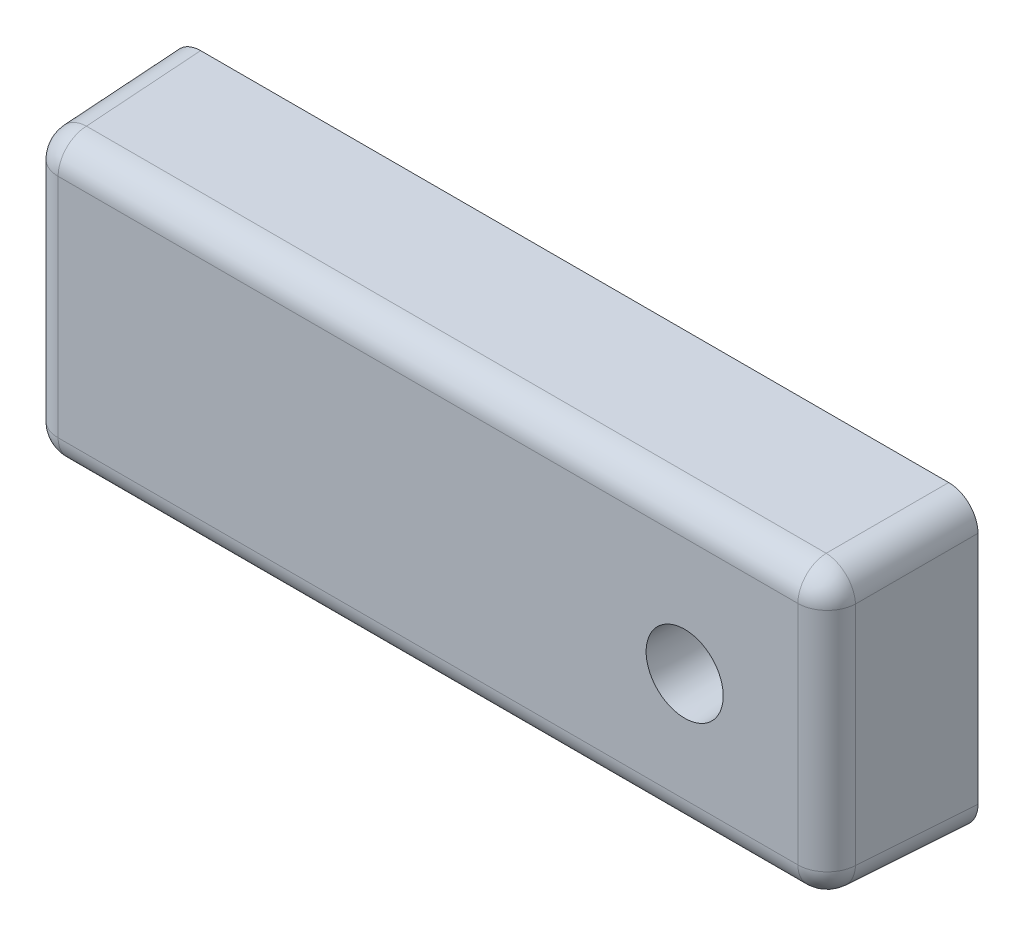
from build123d import *

# Parameters (mm, degrees)
SKETCH1_W           = 55
SKETCH1_H           = 20
SKETCH1_R           = 2.279195974
BOSS_EXTRUDE1_DEPTH = 10
BOSS_EXTRUDE1_DRAFT = 2
FILLET1_R           = 2
FILLET2_R           = 2


with BuildPart() as part:
    # Sketch1 → Boss-Extrude1 (with draft: the straight prism first)
    with BuildSketch(Plane.XY):
        with Locations((-40.5, 12.750475985)):
            Rectangle(SKETCH1_W, SKETCH1_H)
        with Locations((-22.9997867, 12.458174308)):
            Circle(SKETCH1_R, mode=Mode.SUBTRACT)
    extrude(amount=BOSS_EXTRUDE1_DEPTH)
    # Boss-Extrude1: the draft: its side faces are tilted about the plane it starts from
    boss_extrude1_sides = [part.faces().sort_by_distance(p)[0] for p in [
        (-13, 12.750475985, 5),
        (-40.5, 22.750475985, 5),
        (-68, 12.750475985, 5),
        (-40.5, 2.750475985, 5),
        (-25.278982673, 12.458174308, 5),
    ]]
    draft(boss_extrude1_sides, Plane.XY, BOSS_EXTRUDE1_DRAFT)

    # Fillet1
    fillet1_edges = [part.edges().sort_by_distance(p)[0] for p in [
        (-67.650792305, 12.750475985, 10),
        (-40.5, 3.09968368, 10),
        (-13.349207695, 12.750475985, 10),
        (-40.5, 22.40126829, 10),
    ]]
    fillet(fillet1_edges, radius=FILLET1_R)

    # Fillet2
    # the kernel refuses this fillet: 2 mm, written as the material it takes off along each edge
    with BuildSketch(Plane(origin=(-65.719414755, 20.469890741, 8), x_dir=(-0.719128245661317, 0.024250870657585206, -0.6944540744818377), z_dir=(-0.5638062984383352, 0.5638062984383351, 0.6035270629247093))) as fillet2_piece_1_section:
        Polygon((-4.062392326, -4.062392326), (4.062392326, -4.062392326), (4.062392326, 4.062392326), (-4.062392326, 4.062392326), align=None)
    fillet2_piece_1 = extrude(amount=4.062392326, mode=Mode.PRIVATE)
    fillet2_piece_1 = split(fillet2_piece_1, bisect_by=Plane(origin=(-65.719414755, 20.469890741, 8), z_dir=(0.03487826274237467, -0.03487826274237466, 0.9987827659587183)), keep=Keep.TOP, mode=Mode.PRIVATE)
    fillet2_piece_1 = split(fillet2_piece_1, bisect_by=Plane(origin=(-65.719414755, 20.469890741, 8), z_dir=(0, 1, 0)), keep=Keep.TOP, mode=Mode.PRIVATE)
    fillet2_piece_1 = split(fillet2_piece_1, bisect_by=Plane(origin=(-65.719414755, 20.469890741, 8), z_dir=(-1, 0, 0)), keep=Keep.TOP, mode=Mode.PRIVATE)
    fillet2_piece_1 = split(fillet2_piece_1, bisect_by=Plane(origin=(-65.719414755, 22.468672395, 8.069798993), z_dir=(0, -0.9993908270190958, -0.03489949670250102)), keep=Keep.TOP, mode=Mode.PRIVATE)
    fillet2_piece_1 = split(fillet2_piece_1, bisect_by=Plane(origin=(-67.71819641, 20.469890741, 8.069798993), z_dir=(0.9993908270190958, 0, -0.03489949670250102)), keep=Keep.TOP, mode=Mode.PRIVATE)
    fillet2_piece_1 = split(fillet2_piece_1, bisect_by=Plane(origin=(-65.719414755, 20.469890741, 10), z_dir=(0, 0, -1)), keep=Keep.TOP, mode=Mode.PRIVATE)
    fillet2_piece_1 = fillet2_piece_1 - Plane(origin=(-65.719414755, 20.469890741, 8), x_dir=(0.5638062984383352, -0.5638062984383351, -0.6035270629247093), z_dir=(-0.719128245661317, 0.024250870657585206, -0.6944540744818377)) * Sphere(FILLET2_R, mode=Mode.PRIVATE)
    add(fillet2_piece_1, mode=Mode.SUBTRACT)
    with BuildSketch(Plane(origin=(-15.280585245, 20.469890741, 8), x_dir=(0.024250870657585296, 0.719128245661317, -0.6944540744818377), z_dir=(0.5638062984383351, 0.5638062984383351, 0.6035270629247093))) as fillet2_piece_2_section:
        Polygon((-4.062392326, -4.062392326), (4.062392326, -4.062392326), (4.062392326, 4.062392326), (-4.062392326, 4.062392326), align=None)
    fillet2_piece_2 = extrude(amount=4.062392326, mode=Mode.PRIVATE)
    fillet2_piece_2 = split(fillet2_piece_2, bisect_by=Plane(origin=(-15.280585245, 20.469890741, 8), z_dir=(-0.03487826274237467, -0.034878262742374676, 0.9987827659587183)), keep=Keep.TOP, mode=Mode.PRIVATE)
    fillet2_piece_2 = split(fillet2_piece_2, bisect_by=Plane(origin=(-15.280585245, 20.469890741, 8), z_dir=(1, 0, 0)), keep=Keep.TOP, mode=Mode.PRIVATE)
    fillet2_piece_2 = split(fillet2_piece_2, bisect_by=Plane(origin=(-15.280585245, 20.469890741, 8), z_dir=(0, 1, 0)), keep=Keep.TOP, mode=Mode.PRIVATE)
    fillet2_piece_2 = split(fillet2_piece_2, bisect_by=Plane(origin=(-13.28180359, 20.469890741, 8.069798993), z_dir=(-0.9993908270190958, 0, -0.03489949670250102)), keep=Keep.TOP, mode=Mode.PRIVATE)
    fillet2_piece_2 = split(fillet2_piece_2, bisect_by=Plane(origin=(-15.280585245, 22.468672395, 8.069798993), z_dir=(0, -0.9993908270190958, -0.03489949670250102)), keep=Keep.TOP, mode=Mode.PRIVATE)
    fillet2_piece_2 = split(fillet2_piece_2, bisect_by=Plane(origin=(-15.280585245, 20.469890741, 10), z_dir=(0, 0, -1)), keep=Keep.TOP, mode=Mode.PRIVATE)
    fillet2_piece_2 = fillet2_piece_2 - Plane(origin=(-15.280585245, 20.469890741, 8), x_dir=(-0.5638062984383351, -0.5638062984383351, -0.6035270629247093), z_dir=(0.024250870657585296, 0.719128245661317, -0.6944540744818377)) * Sphere(FILLET2_R, mode=Mode.PRIVATE)
    add(fillet2_piece_2, mode=Mode.SUBTRACT)
    with BuildSketch(Plane(origin=(-65.719414755, 5.03106123, 8), x_dir=(0.7191282456613168, 0.0242508706575854, 0.6944540744818378), z_dir=(-0.5638062984383351, -0.5638062984383351, 0.6035270629247093))) as fillet2_piece_3_section:
        Polygon((-4.062392326, -4.062392326), (4.062392326, -4.062392326), (4.062392326, 4.062392326), (-4.062392326, 4.062392326), align=None)
    fillet2_piece_3 = extrude(amount=4.062392326, mode=Mode.PRIVATE)
    fillet2_piece_3 = split(fillet2_piece_3, bisect_by=Plane(origin=(-65.719414755, 5.03106123, 8), z_dir=(0.03487826274237467, 0.034878262742374676, 0.9987827659587183)), keep=Keep.TOP, mode=Mode.PRIVATE)
    fillet2_piece_3 = split(fillet2_piece_3, bisect_by=Plane(origin=(-65.719414755, 5.03106123, 8), z_dir=(0, -1, 0)), keep=Keep.TOP, mode=Mode.PRIVATE)
    fillet2_piece_3 = split(fillet2_piece_3, bisect_by=Plane(origin=(-65.719414755, 5.03106123, 8), z_dir=(-1, 0, 0)), keep=Keep.TOP, mode=Mode.PRIVATE)
    fillet2_piece_3 = split(fillet2_piece_3, bisect_by=Plane(origin=(-65.719414755, 3.032279576, 8.069798993), z_dir=(0, 0.9993908270190958, -0.03489949670250102)), keep=Keep.TOP, mode=Mode.PRIVATE)
    fillet2_piece_3 = split(fillet2_piece_3, bisect_by=Plane(origin=(-67.71819641, 5.03106123, 8.069798993), z_dir=(0.9993908270190958, 0, -0.03489949670250102)), keep=Keep.TOP, mode=Mode.PRIVATE)
    fillet2_piece_3 = split(fillet2_piece_3, bisect_by=Plane(origin=(-65.719414755, 5.03106123, 10), z_dir=(0, 0, -1)), keep=Keep.TOP, mode=Mode.PRIVATE)
    fillet2_piece_3 = fillet2_piece_3 - Plane(origin=(-65.719414755, 5.03106123, 8), x_dir=(0.5638062984383351, 0.5638062984383351, -0.6035270629247093), z_dir=(0.7191282456613168, 0.0242508706575854, 0.6944540744818378)) * Sphere(FILLET2_R, mode=Mode.PRIVATE)
    add(fillet2_piece_3, mode=Mode.SUBTRACT)
    with BuildSketch(Plane(origin=(-15.280585245, 5.03106123, 8), x_dir=(-0.024250870657585296, 0.719128245661317, 0.6944540744818377), z_dir=(0.5638062984383352, -0.5638062984383351, 0.6035270629247093))) as fillet2_piece_4_section:
        Polygon((-4.062392326, -4.062392326), (4.062392326, -4.062392326), (4.062392326, 4.062392326), (-4.062392326, 4.062392326), align=None)
    fillet2_piece_4 = extrude(amount=4.062392326, mode=Mode.PRIVATE)
    fillet2_piece_4 = split(fillet2_piece_4, bisect_by=Plane(origin=(-15.280585245, 5.03106123, 8), z_dir=(-0.03487826274237467, 0.03487826274237466, 0.9987827659587183)), keep=Keep.TOP, mode=Mode.PRIVATE)
    fillet2_piece_4 = split(fillet2_piece_4, bisect_by=Plane(origin=(-15.280585245, 5.03106123, 8), z_dir=(1, 0, 0)), keep=Keep.TOP, mode=Mode.PRIVATE)
    fillet2_piece_4 = split(fillet2_piece_4, bisect_by=Plane(origin=(-15.280585245, 5.03106123, 8), z_dir=(0, -1, 0)), keep=Keep.TOP, mode=Mode.PRIVATE)
    fillet2_piece_4 = split(fillet2_piece_4, bisect_by=Plane(origin=(-13.28180359, 5.03106123, 8.069798993), z_dir=(-0.9993908270190958, 0, -0.03489949670250102)), keep=Keep.TOP, mode=Mode.PRIVATE)
    fillet2_piece_4 = split(fillet2_piece_4, bisect_by=Plane(origin=(-15.280585245, 3.032279576, 8.069798993), z_dir=(0, 0.9993908270190958, -0.03489949670250102)), keep=Keep.TOP, mode=Mode.PRIVATE)
    fillet2_piece_4 = split(fillet2_piece_4, bisect_by=Plane(origin=(-15.280585245, 5.03106123, 10), z_dir=(0, 0, -1)), keep=Keep.TOP, mode=Mode.PRIVATE)
    fillet2_piece_4 = fillet2_piece_4 - Plane(origin=(-15.280585245, 5.03106123, 8), x_dir=(-0.5638062984383352, 0.5638062984383351, -0.6035270629247093), z_dir=(-0.024250870657585296, 0.719128245661317, 0.6944540744818377)) * Sphere(FILLET2_R, mode=Mode.PRIVATE)
    add(fillet2_piece_4, mode=Mode.SUBTRACT)
    with BuildSketch(Plane(origin=(-12.825820961, 2.576296946, -4.987835068), x_dir=(0.0012172338155652697, 0.9993915682994698, -0.034857015847091166), z_dir=(-0.03487826274237467, 0.03487826274237466, 0.9987827659587183)), Plane(origin=(-68.174179039, 2.576296946, -4.987835068), x_dir=(0.99939156829947, -0.0012172338155659363, -0.034857015847091145), z_dir=(0.03487826274237467, 0.034878262742374676, 0.9987827659587183))) as fillet2_piece_5:
        with BuildLine():
            CenterArc((FILLET2_R * 0.998782765959, FILLET2_R), FILLET2_R, 180.069784837, 89.930215163)
            Line((-FILLET2_R * 0.00121649230961, FILLET2_R * 0.99878202513), (0, 0))
            Line((0, 0), (FILLET2_R * 0.998782765959, 0))
        make_face()
    extrude(amount=13.14326166, mode=Mode.SUBTRACT)
    with BuildSketch(Plane(origin=(-68.174179039, 22.924655024, -4.987835068), x_dir=(0.99939156829947, 0.001217233815566174, -0.03485701584709114), z_dir=(0.03487826274237467, -0.03487826274237466, 0.9987827659587183)), Plane(origin=(-12.825820961, 22.924655024, -4.987835068), x_dir=(0.0012172338155670467, -0.9993915682994698, -0.03485701584709112), z_dir=(-0.03487826274237467, -0.034878262742374676, 0.9987827659587183))) as fillet2_piece_6:
        with BuildLine():
            CenterArc((FILLET2_R * 0.998782765959, -FILLET2_R), FILLET2_R, 90, 89.930215163)
            Line((-FILLET2_R * 0.00121649230961, -FILLET2_R * 0.99878202513), (0, 0))
            Line((0, 0), (FILLET2_R * 0.998782765959, 0))
        make_face()
    extrude(amount=13.14326166, mode=Mode.SUBTRACT)


solid = part.part
